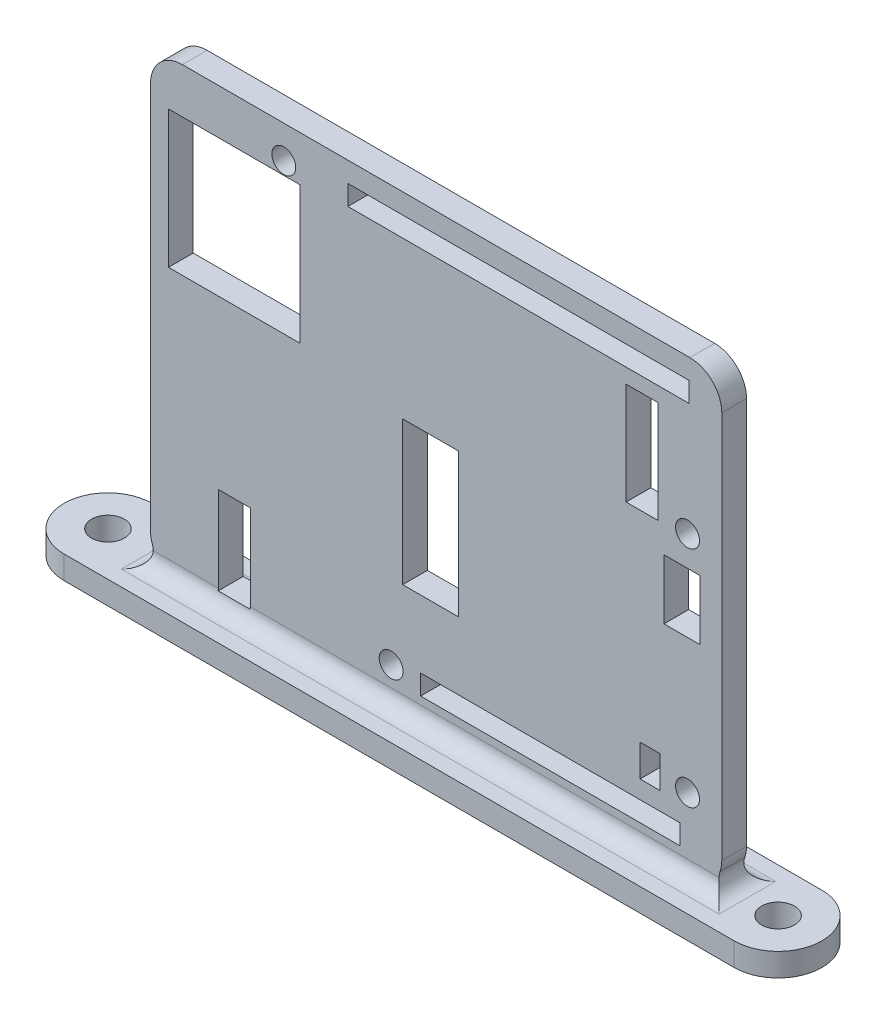
from build123d import *
from build123d.topology import SkipClean

# Parameters (mm, degrees)
SKETCH1_R           = 1.5
SKETCH1_W           = 16.5
SKETCH1_H           = 17.2
SKETCH1_W_2         = 7
SKETCH1_H_2         = 18
SKETCH1_W_3         = 42.75
SKETCH1_H_3         = 2.5
SKETCH1_W_4         = 4
SKETCH1_H_4         = 12.8
SKETCH1_W_5         = 4.5
SKETCH1_H_5         = 7.5
SKETCH1_W_6         = 2.5
SKETCH1_H_6         = 4
SKETCH1_W_7         = 32.5
SKETCH1_H_7         = 11
BOSS_EXTRUDE1_DEPTH = 3.1
SKETCH2_R           = 2.0635
BOSS_EXTRUDE2_DEPTH = 2.9
FILLET1_DEPTH       = 3.1
FILLET1_START       = -36.769210249
FILLET1_2_DEPTH     = 74.923708499
FILLET1_START_2     = -22.61
FILLET1_3_DEPTH     = 60.0761
FILLET1_START_3     = -36.399689195
FILLET1_4_DEPTH     = 9.789689195
FILLET1_START_4     = -2
FILLET1_5_DEPTH     = 7.1


with BuildPart() as part:
    # Sketch1 → Boss-Extrude1 (new body)
    with BuildSketch(Plane.XY):
        with BuildLine():
            Line((-35.112356, 2.278375887), (-35.112356, 50.868606365))
            ThreePointArc((-35.112356, 50.868606365), (-33.940783125, 53.697033489), (-31.112356, 54.868606365))
            Line((-31.112356, 54.868606365), (32.497644, 54.868606365))
            ThreePointArc((32.497644, 54.868606365), (35.326071125, 53.697033489), (36.497644, 50.868606365))
            Line((36.497644, 50.868606365), (36.497644, 2.278375887))
            ThreePointArc((36.497644, 2.278375887), (35.326071125, -0.550051237), (32.497644, -1.721624113))
            Line((32.497644, -1.721624113), (-31.112356, -1.721624113))
            ThreePointArc((-31.112356, -1.721624113), (-33.940783125, -0.550051237), (-35.112356, 2.278375887))
        make_face()
        with Locations(Location((-18.41, 50.790230477, 0), (0, 0, 180))):
            Circle(SKETCH1_R, mode=Mode.SUBTRACT)
        with Locations(Location((-4.95, 2.8, 0), (0, 0, 180))):
            Circle(SKETCH1_R, mode=Mode.SUBTRACT)
        with Locations(Location((32.2, 7.5, 0), (0, 0, 180))):
            Circle(SKETCH1_R, mode=Mode.SUBTRACT)
        with Locations(Location((32.2, 35.590230477, 0), (0, 0, 180))):
            Circle(SKETCH1_R, mode=Mode.SUBTRACT)
        with Locations((-24.61, 40.590230477)):
            Rectangle(SKETCH1_W, SKETCH1_H, mode=Mode.SUBTRACT)
        with Locations((0, 21.22)):
            Rectangle(SKETCH1_W_2, SKETCH1_H_2, mode=Mode.SUBTRACT)
        with Locations((11, 51.090230477)):
            Rectangle(SKETCH1_W_3, SKETCH1_H_3, mode=Mode.SUBTRACT)
        with Locations((26.5, 41.590230477)):
            Rectangle(SKETCH1_W_4, SKETCH1_H_4, mode=Mode.SUBTRACT)
        with Locations((31.5, 28.090230477)):
            Rectangle(SKETCH1_W_5, SKETCH1_H_5, mode=Mode.SUBTRACT)
        with Locations((27.5, 8)):
            Rectangle(SKETCH1_W_6, SKETCH1_H_6, mode=Mode.SUBTRACT)
        with Locations((15, 2.5)):
            Rectangle(SKETCH1_W_7, SKETCH1_H_3, mode=Mode.SUBTRACT)
        with Locations((-24.61, 5.5)):
            Rectangle(SKETCH1_W_4, SKETCH1_H_7, mode=Mode.SUBTRACT)
    extrude(amount=BOSS_EXTRUDE1_DEPTH)

    # Sketch2 → Boss-Extrude2 (add)
    with BuildSketch(Plane(origin=(0, -1.721624113, 0), x_dir=(-1, 0, 0), z_dir=(0, -1, 0))):
        with BuildLine():
            Line((42, 3.95), (-42, 3.95))
            ThreePointArc((-42, 3.95), (-47.5, -1.55), (-42, -7.05))
            Line((-42, -7.05), (42, -7.05))
            ThreePointArc((42, -7.05), (47.5, -1.55), (42, 3.95))
        make_face()
        with Locations(Location((-42, -1.55, 0), (0, 0, 90))):
            Circle(SKETCH2_R, mode=Mode.SUBTRACT)
        with Locations(Location((42, -1.55, 0), (0, 0, 90))):
            Circle(SKETCH2_R, mode=Mode.SUBTRACT)
    extrude(amount=BOSS_EXTRUDE2_DEPTH)

    # Fillet1: read off the stored shape, not the designer's step
    # Fillet1 outline → Fillet1 (add)
    with BuildSketch(Plane.XY):
        with BuildLine():
            ThreePointArc((-31.112356, -1.721624113), (-33.421757077, -0.987610436), (-34.883592166, 0.945042554))
            ThreePointArc((-34.883592166, 0.945042554), (-35.136217087, -0.876324651), (-36.769210249, -1.721624113))
            Line((-36.769210249, -1.721624113), (-31.112356, -1.721624113))
        make_face()
        with BuildLine():
            ThreePointArc((36.268880166, 0.945042554), (34.807045077, -0.987610436), (32.497644, -1.721624113))
            Line((32.497644, -1.721624113), (38.15449825, -1.721624113))
            ThreePointArc((38.15449825, -1.721624113), (36.521505088, -0.876324651), (36.268880166, 0.945042554))
        make_face()
    extrude(amount=FILLET1_DEPTH)

    # Fillet1 2 outline → Fillet1 2 (add)
    with BuildSketch(Plane.YZ.offset(FILLET1_START)):
        with BuildLine():
            ThreePointArc((0, 3.119468035), (-1.231053106, 3.787893254), (-1.721624113, 5.1))
            Line((-1.721624113, 5.1), (-1.721624113, 3.1))
            Line((-1.721624113, 3.1), (0, 3.1))
            Line((0, 3.1), (0, 3.119468035))
        make_face()
        with BuildLine():
            Line((0, 0), (-1.721624113, 0))
            Line((-1.721624113, 0), (-1.721624113, -2))
            ThreePointArc((-1.721624113, -2), (-1.231053106, -0.687893254), (0, -0.019468035))
            Line((0, -0.019468035), (0, 0))
        make_face()
    extrude(amount=FILLET1_2_DEPTH)

    # Fillet1 3 outline → Fillet1 3 (add)
    with BuildSketch(Plane.YZ.offset(FILLET1_START_2)):
        with BuildLine():
            ThreePointArc((0.278375887, 3.1), (0.138847988, 3.104872945), (0, 3.119468035))
            Line((0, 3.119468035), (0, 3.1))
            Line((0, 3.1), (0.278375887, 3.1))
        make_face()
        with BuildLine():
            Line((0.278375887, 0), (0, 0))
            Line((0, 0), (0, -0.019468035))
            ThreePointArc((0, -0.019468035), (0.138847988, -0.004872945), (0.278375887, 0))
        make_face()
    extrude(amount=FILLET1_3_DEPTH)

    # Fillet1 4 outline → Fillet1 4 (add)
    with BuildSketch(Plane.YZ.offset(FILLET1_START_3)):
        with BuildLine():
            ThreePointArc((0.278375887, 3.1), (0.138847988, 3.104872945), (0, 3.119468035))
            Line((0, 3.119468035), (0, 3.1))
            Line((0, 3.1), (0.278375887, 3.1))
        make_face()
        with BuildLine():
            Line((0.278375887, 0), (0, 0))
            Line((0, 0), (0, -0.019468035))
            ThreePointArc((0, -0.019468035), (0.138847988, -0.004872945), (0.278375887, 0))
        make_face()
    extrude(amount=FILLET1_4_DEPTH)

    # Fillet1 5 outline → Fillet1 5 (cut)
    with SkipClean():  # the faces are left unmerged after this step: merging them gives an invalid solid
        with BuildSketch(Plane.XY.offset(FILLET1_START_4)):
            with BuildLine():
                Line((-36.399689195, 0.278375887), (-36.399689195, 0))
                Line((-36.399689195, 0), (-36.769210249, 0))
                Line((-36.769210249, 0), (-36.769210249, -1.721624113))
                ThreePointArc((-36.769210249, -1.721624113), (-35.354996687, -1.135837675), (-34.769210249, 0.278375887))
                Line((-34.769210249, 0.278375887), (-36.399689195, 0.278375887))
            make_face()
            with BuildLine():
                Line((38.15449825, -1.721624113), (38.15449825, 0))
                Line((38.15449825, 0), (37.4661, 0))
                Line((37.4661, 0), (37.4661, 0.278375887))
                Line((37.4661, 0.278375887), (36.15449825, 0.278375887))
                ThreePointArc((36.15449825, 0.278375887), (36.740284688, -1.135837675), (38.15449825, -1.721624113))
            make_face()
        extrude(amount=FILLET1_5_DEPTH, mode=Mode.SUBTRACT)


solid = part.part
